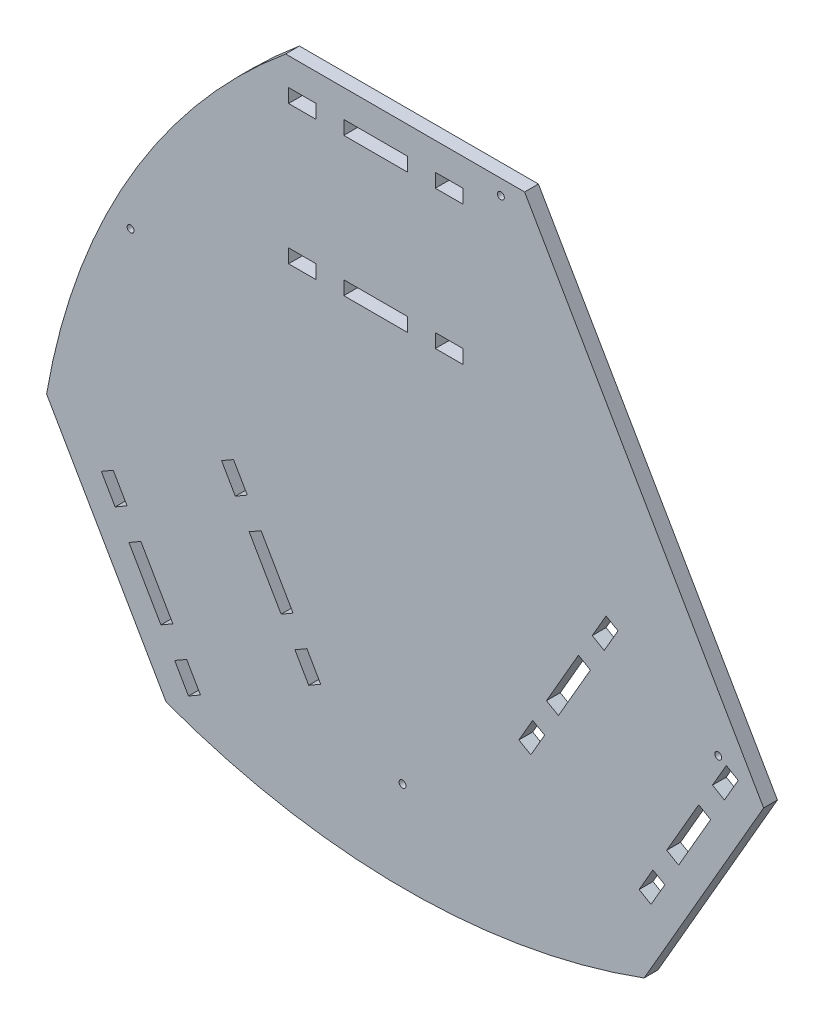
from build123d import *

# Parameters (mm, degrees)
BOSS_EXTRUDE1_DEPTH = 5
BOSS_EXTRUDE2_DEPTH = 5
SKETCH4_W           = 10
SKETCH4_H           = 5
SKETCH4_W_2         = 23.171924429
CUT_EXTRUDE2_DEPTH  = 5
BOSS_EXTRUDE3_DEPTH = 5
SKETCH7_R           = 1.25
CUT_EXTRUDE4_DEPTH  = 5


with BuildPart() as part:
    # Sketch1 → Boss-Extrude1 (new body)
    with BuildSketch(Plane(origin=(0, 0, 0), x_dir=(0.8660254037844434, -0.49999999999999206, 0), z_dir=(0, 0, 1))):
        Polygon((125, -43.301270189), (125, 43.301270189), (-25, 129.903810568), (-100, 86.602540378), (-100, -86.602540378), (-25, -129.903810568), align=None)
    extrude(amount=BOSS_EXTRUDE1_DEPTH)

    # Sketch3 → Boss-Extrude2 (add)
    with BuildSketch(Plane.XY.offset(5)):
        Polygon((-86.602540378, -100), (86.602540378, -100), (129.903810568, -25), (43.301270189, 125), (-43.301270189, 125), (-129.903810568, -25), align=None)
    extrude(amount=-BOSS_EXTRUDE2_DEPTH)

    # Sketch4 → Cut-Extrude2 (cut)
    with BuildSketch(Plane.XY.offset(5)):
        with Locations((-37.221924429, 112.5)):
            Rectangle(SKETCH4_W, SKETCH4_H)
        with Locations((15.95, 112.5)):
            Rectangle(SKETCH4_W, SKETCH4_H)
        with Locations((-10.635962215, 112.5)):
            Rectangle(SKETCH4_W_2, SKETCH4_H)
        with Locations((-37.221924429, 62.1999492)):
            Rectangle(SKETCH4_W, SKETCH4_H)
        with Locations((15.95, 62.1999492)):
            Rectangle(SKETCH4_W, SKETCH4_H)
        with Locations((-10.635962215, 62.1999492)):
            Rectangle(SKETCH4_W_2, SKETCH4_H)
        Polygon((116.373756631, -18.434740848), (111.373756631, -27.094994886), (115.70388365, -29.594994886), (120.70388365, -20.934740848), align=None)
        Polygon((84.787794416, -73.143232209), (89.117921435, -75.643232209), (94.117921435, -66.982978171), (89.787794416, -64.482978171), align=None)
        Polygon((110.70388365, -38.255248924), (106.373756631, -35.755248924), (94.787794416, -55.822724134), (99.117921435, -58.322724134), align=None)
        Polygon((72.812634826, 6.715284552), (67.812634826, -1.944969486), (72.142761845, -4.444969486), (77.142761845, 4.215284552), align=None)
        Polygon((41.226672612, -47.993206809), (45.556799631, -50.493206809), (50.556799631, -41.832952771), (46.226672612, -39.332952771), align=None)
        Polygon((67.142761845, -13.105223524), (62.812634826, -10.605223524), (51.226672612, -30.672698734), (55.556799631, -33.172698734), align=None)
        Polygon((-74.151832202, -91.565259152), (-79.151832202, -82.905005114), (-83.481959221, -85.405005114), (-78.481959221, -94.065259152), align=None)
        Polygon((-105.737794416, -36.856767791), (-110.067921435, -39.356767791), (-105.067921435, -48.017021829), (-100.737794416, -45.517021829), align=None)
        Polygon((-88.481959221, -76.744751076), (-84.151832202, -74.244751076), (-95.737794416, -54.177275866), (-100.067921435, -56.677275866), align=None)
        Polygon((-30.590710397, -66.415233752), (-35.590710397, -57.754979714), (-39.920837416, -60.254979714), (-34.920837416, -68.915233752), align=None)
        Polygon((-62.176672612, -11.706742391), (-66.506799631, -14.206742391), (-61.506799631, -22.866996429), (-57.176672612, -20.366996429), align=None)
        Polygon((-44.920837416, -51.594725676), (-40.590710397, -49.094725676), (-52.176672612, -29.027250466), (-56.506799631, -31.527250466), align=None)
    extrude(amount=-CUT_EXTRUDE2_DEPTH, mode=Mode.SUBTRACT)

    # Sketch5 → Boss-Extrude3 (add)
    with BuildSketch(Plane.XY.offset(5)):
        with BuildLine():
            ThreePointArc((-43.301270189, 125), (-100.007931209, 57.739606004), (-129.903810568, -25))
            Line((-129.903810568, -25), (-43.301270189, 125))
        make_face()
        with BuildLine():
            ThreePointArc((-86.602540378, -100), (0, -115.479212009), (86.602540378, -100))
            Line((86.602540378, -100), (-86.602540378, -100))
        make_face()
    extrude(amount=-BOSS_EXTRUDE3_DEPTH)

    # Sketch7 → Cut-Extrude4 (cut)
    with BuildSketch(Plane.XY.offset(5)):
        with Locations((-99.474904421, 42.045588536)):
            Circle(SKETCH7_R)
        with Locations((34.707071641, 119.515588536)):
            Circle(SKETCH7_R)
        with Locations((113.447071641, -16.866092052)):
            Circle(SKETCH7_R)
        with Locations((-0.937563691, -82.906092052)):
            Circle(SKETCH7_R)
    extrude(amount=-CUT_EXTRUDE4_DEPTH, mode=Mode.SUBTRACT)


solid = part.part
